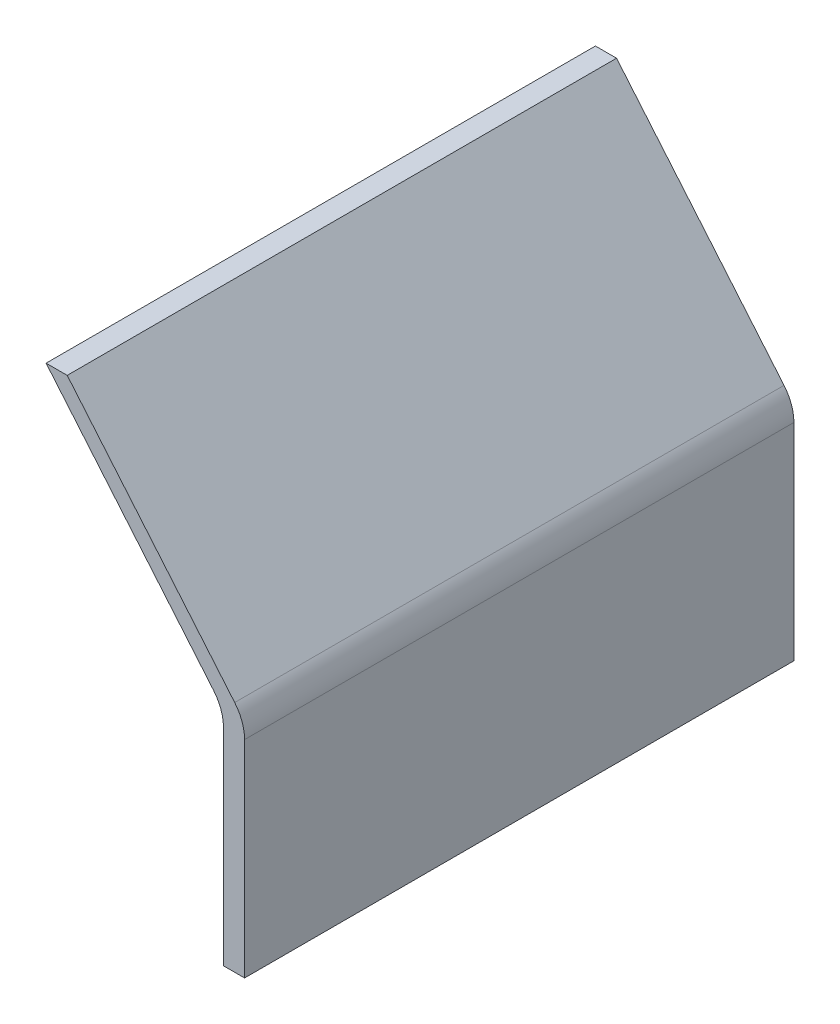
from build123d import *

# Parameters (mm, degrees)
FUNNEL_LEFT_SIDE_DEPTH = 130
FILLET1_R              = 10


with BuildPart() as part:
    # Sketch1 → Funnel - Left Side (new body)
    with BuildSketch(Plane.XY):
        Polygon((0, 0), (-5, 0), (-5, 52.5), (-46.974030913, 102.522702136), (-41.974030913, 102.522702136), (0, 52.5), align=None)
    extrude(amount=FUNNEL_LEFT_SIDE_DEPTH)

    # Fillet1
    fillet1_edges = [part.edges().sort_by_distance(p)[0] for p in [
        (0, 52.5, 65),
        (-5, 52.5, 65),
    ]]
    fillet(fillet1_edges, radius=FILLET1_R)


solid = part.part
